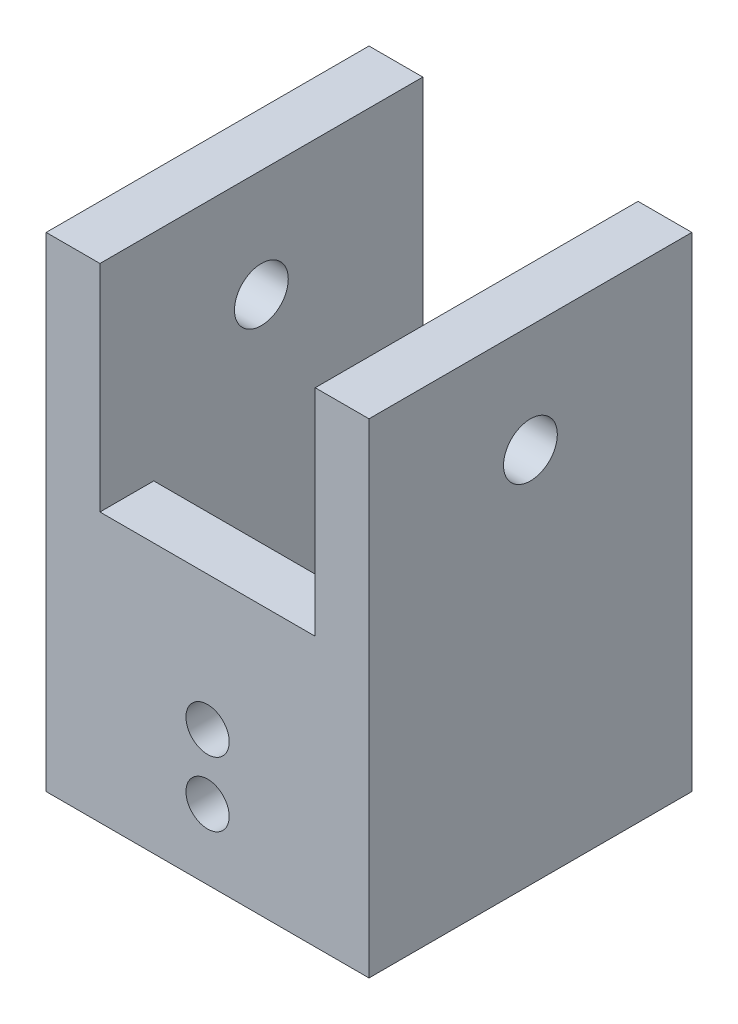
from build123d import *

# Parameters (mm, degrees)
SKETCH1_W                   = 38.1
SKETCH1_H                   = 38.1
SKETCH1_W_2                 = 25.4
SKETCH1_H_2                 = 25.4
BOSS_EXTRUDE1_DEPTH         = 57.15
SKETCH2_W                   = 25.4
SKETCH2_H                   = 25.4
CUT_EXTRUDE1_DEPTH          = 79.545162168
CUT_EXTRUDE2_DEPTH          = 79.545162168
CUT_EXTRUDE2_DEPTH_BACK     = 79.545162168
SKETCH3_R                   = 3.175
F_1_4_20_TAPPED_HOLE1_D     = 5.1054
F_1_4_20_TAPPED_HOLE1_DEPTH = 16.51
F_1_4_20_TAPPED_HOLE1_TIP   = 1.533816902
SKETCH7_R                   = 3.175
CUT_EXTRUDE3_DEPTH          = 6.35


with BuildPart() as part:
    # Sketch1 → Boss-Extrude1 (new body)
    with BuildSketch(Plane(origin=(0, 0, 0), x_dir=(1, 0, 0), z_dir=(0, 1, 0))):
        with Locations((19.05, 19.05)):
            Rectangle(SKETCH1_W, SKETCH1_H)
        with Locations((19.05, 19.05)):
            Rectangle(SKETCH1_W_2, SKETCH1_H_2, mode=Mode.SUBTRACT)
    extrude(amount=BOSS_EXTRUDE1_DEPTH)

    # Sketch2 → Cut-Extrude1 (cut, through all)
    with BuildSketch(Plane.XY):
        with Locations((19.05, 44.45)):
            Rectangle(SKETCH2_W, SKETCH2_H)
    extrude(amount=-CUT_EXTRUDE1_DEPTH, mode=Mode.SUBTRACT)

    # Sketch3 → Cut-Extrude2 (cut, two sides: drawn at the far end of the back side and taken through both)
    with BuildSketch(Plane(origin=(38.1, 0, 0), x_dir=(0, 0, -1), z_dir=(1, 0, 0)).offset(-CUT_EXTRUDE2_DEPTH_BACK)):
        with Locations((19.05, 44.45)):
            Circle(SKETCH3_R)
    extrude(amount=CUT_EXTRUDE2_DEPTH + CUT_EXTRUDE2_DEPTH_BACK, mode=Mode.SUBTRACT)

    # 1/4-20 Tapped Hole1
    with Locations(Plane(origin=(0, 0, -6.35), x_dir=(-1, 0, 0), z_dir=(0, 0, -1))):
        with Locations((-19.05, 15.875), (-19.05, 8.255)):
            Hole(F_1_4_20_TAPPED_HOLE1_D / 2, depth=F_1_4_20_TAPPED_HOLE1_DEPTH)
            with Locations((0, 0, -(F_1_4_20_TAPPED_HOLE1_DEPTH + F_1_4_20_TAPPED_HOLE1_TIP / 2))):  # 118° drill point
                Cone(0, F_1_4_20_TAPPED_HOLE1_D / 2, F_1_4_20_TAPPED_HOLE1_TIP, mode=Mode.SUBTRACT)

    # Sketch7 → Cut-Extrude3 (cut)
    with BuildSketch(Plane(origin=(0, 0, -38.1), x_dir=(-1, 0, 0), z_dir=(0, 0, -1))):
        with Locations((-19.05, 15.875)):
            Circle(SKETCH7_R)
        with Locations((-19.05, 8.255)):
            Circle(SKETCH7_R)
    extrude(amount=-CUT_EXTRUDE3_DEPTH, mode=Mode.SUBTRACT)


solid = part.part
